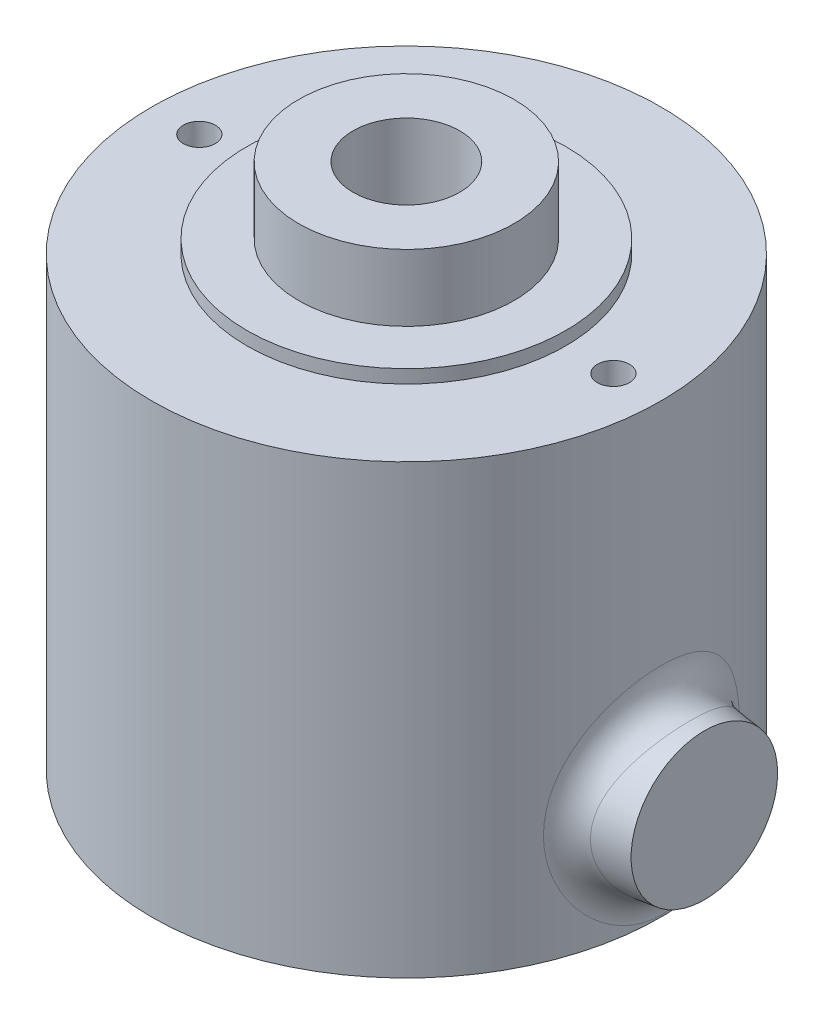
from build123d import *

# Parameters (mm, degrees)
SKETCH2_R           = 19.1
BOSS_EXTRUDE1_DEPTH = 33.53
SKETCH3_R           = 11.955
SKETCH3_R_2         = 8.075
BOSS_EXTRUDE2_DEPTH = 1
SKETCH3_2_R         = 8.075
SKETCH3_2_R_2       = 4
BOSS_EXTRUDE3_DEPTH = 6
SKETCH4_R           = 1.2
CUT_EXTRUDE1_DEPTH  = 6
SKETCH5_R           = 8.24
BOSS_EXTRUDE4_DEPTH = 22.35
BOSS_EXTRUDE4_TAPER = 7
FILLET1_R           = 2.5


with BuildPart() as part:
    # Sketch2 → Boss-Extrude1 (new body)
    with BuildSketch(Plane(origin=(0, 0, 0), x_dir=(1, 0, 0), z_dir=(0, 1, 0))):
        Circle(SKETCH2_R)
    extrude(amount=BOSS_EXTRUDE1_DEPTH)

    # Sketch3 → Boss-Extrude2 (add)
    with BuildSketch(Plane(origin=(0, 33.53, 0), x_dir=(1, 0, 0), z_dir=(0, 1, 0))):
        Circle(SKETCH3_R)
        Circle(SKETCH3_R_2, mode=Mode.SUBTRACT)
    extrude(amount=BOSS_EXTRUDE2_DEPTH)

    # Sketch3<2> → Boss-Extrude3 (add)
    with BuildSketch(Plane(origin=(0, 33.53, 0), x_dir=(1, 0, 0), z_dir=(0, 1, 0))):
        Circle(SKETCH3_2_R)
        Circle(SKETCH3_2_R_2, mode=Mode.SUBTRACT)
    extrude(amount=BOSS_EXTRUDE3_DEPTH)

    # Sketch4 → Cut-Extrude1 (cut)
    with BuildSketch(Plane(origin=(0, 33.53, 0), x_dir=(1, 0, 0), z_dir=(0, 1, 0))):
        with Locations((-15.5275, 0)):
            Circle(SKETCH4_R)
        with Locations((15.5275, 0)):
            Circle(SKETCH4_R)
    extrude(amount=-CUT_EXTRUDE1_DEPTH, mode=Mode.SUBTRACT)

    # Sketch5 → Boss-Extrude4 (add)
    with BuildSketch(Plane(origin=(0, 0, 0), x_dir=(0, 0, -1), z_dir=(1, 0, 0))):
        with Locations((0, 8.24)):
            Circle(SKETCH5_R)
    extrude(amount=BOSS_EXTRUDE4_DEPTH, taper=BOSS_EXTRUDE4_TAPER)

    # Fillet1
    fillet1_edges = [part.edges().sort_by_distance(p)[0] for p in [
        (18.128445003, 8.239999998, 6.014106781),
    ]]
    fillet(fillet1_edges, radius=FILLET1_R)


solid = part.part
